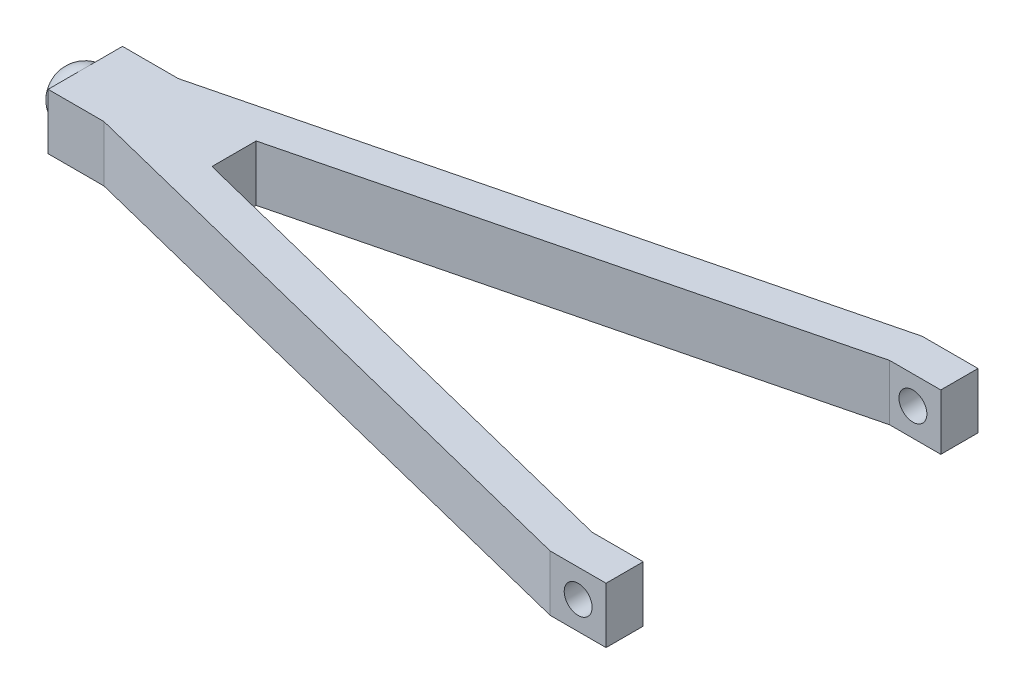
from build123d import *

# Parameters (mm, degrees)
BOSS_EXTRUDE1_DEPTH     = 38.1
CUT_EXTRUDE1_DEPTH      = 564.578151191
CUT_EXTRUDE1_DEPTH_BACK = 564.578151191
SKETCH3_R               = 9.525


with BuildPart() as part:
    # Sketch1 → Boss-Extrude1 (new body)
    with BuildSketch(Plane(origin=(0, 0, 0), x_dir=(1, 0, 0), z_dir=(0, 1, 0))):
        Polygon((-38.1, 127), (-444.5, 25.4), (-482.6, 25.4), (-482.6, -25.4), (-444.5, -25.4), (-38.1, -127), (0, -127), (0, -101.6), (-34.973117109, -101.6), (-381, -15.093279277), (-381, 15.093279277), (-34.973117109, 101.6), (0, 101.6), (0, 127), align=None)
    extrude(amount=BOSS_EXTRUDE1_DEPTH)


with BuildPart() as revolve1_tool:
    # Sketch2 → Revolve1 (revolve)
    with BuildSketch(Plane.XY):
        with BuildLine():
            Line((-482.6, 0), (-482.6, 38.1))
            ThreePointArc((-482.6, 38.1), (-501.65, 19.05), (-482.6, 0))
        make_face()
    revolve(axis=Axis((-482.6, 38.1, 0), (0, -1, 0)))


with BuildPart() as part_1:
    add(part.part)


with BuildPart() as part_2:
    # Revolve1: joined with revolve1_tool
    add(part_1.part.fuse(revolve1_tool.part, tol=0.00001))

    # Sketch3 → Cut-Extrude1 (cut, two sides: drawn at the far end of the back side and taken through both)
    with BuildSketch(Plane.XY.offset(127).offset(-CUT_EXTRUDE1_DEPTH_BACK)):
        with Locations((-19.05, 19.05)):
            Circle(SKETCH3_R)
    extrude(amount=CUT_EXTRUDE1_DEPTH + CUT_EXTRUDE1_DEPTH_BACK, mode=Mode.SUBTRACT)


solid = part_2.part
